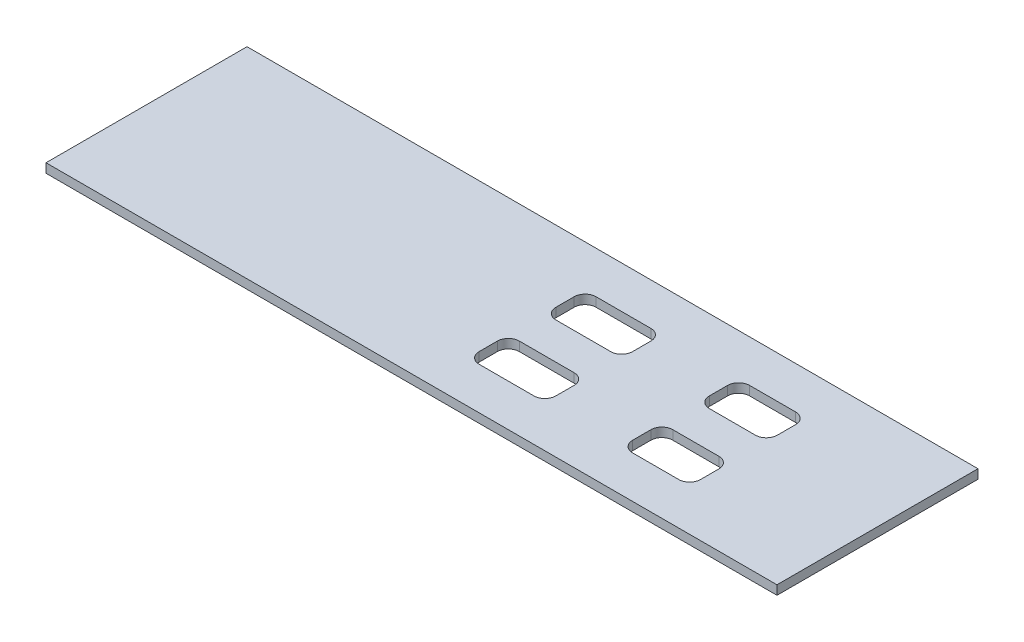
from build123d import *

# Parameters (mm, degrees)
SKETCH1_W           = 152.4
SKETCH1_H           = 69.85
BOSS_EXTRUDE1_DEPTH = 3.175
SKETCH2_W           = 26.67
SKETCH2_H           = 13.97
SKETCH2_W_2         = 23.622
CUT_EXTRUDE1_DEPTH  = 168.674873267
FILLET1_R           = 3.81
SKETCH4_W           = 69.85
SKETCH4_H           = 3.175
BOSS_EXTRUDE2_DEPTH = 101.6


with BuildPart() as part:
    # Sketch1 → Boss-Extrude1 (new body)
    with BuildSketch(Plane(origin=(0, 0, 0), x_dir=(1, 0, 0), z_dir=(0, 1, 0))):
        with Locations((76.2, 34.925)):
            Rectangle(SKETCH1_W, SKETCH1_H)
    extrude(amount=BOSS_EXTRUDE1_DEPTH)

    # Sketch2 → Cut-Extrude1 (cut, through all)
    with BuildSketch(Plane(origin=(0, 3.175, 0), x_dir=(1, 0, 0), z_dir=(0, 1, 0))):
        with Locations((43.815, 48.26)):
            Rectangle(SKETCH2_W, SKETCH2_H)
        with Locations((95.631, 48.26)):
            Rectangle(SKETCH2_W_2, SKETCH2_H)
        with Locations((43.815, 21.59)):
            Rectangle(SKETCH2_W, SKETCH2_H)
        with Locations((95.631, 21.59)):
            Rectangle(SKETCH2_W_2, SKETCH2_H)
    extrude(amount=-CUT_EXTRUDE1_DEPTH, mode=Mode.SUBTRACT)

    # Fillet1
    fillet1_edges = [part.edges().sort_by_distance(p)[0] for p in [
        (83.82, 1.5875, -14.605),
        (83.82, 1.5875, -41.275),
        (30.48, 1.5875, -41.275),
        (30.48, 1.5875, -14.605),
        (107.442, 1.5875, -14.605),
        (57.15, 1.5875, -41.275),
        (57.15, 1.5875, -14.605),
        (107.442, 1.5875, -41.275),
        (107.442, 1.5875, -28.575),
        (107.442, 1.5875, -55.245),
        (57.15, 1.5875, -28.575),
        (57.15, 1.5875, -55.245),
        (30.48, 1.5875, -28.575),
        (83.82, 1.5875, -28.575),
        (83.82, 1.5875, -55.245),
        (30.48, 1.5875, -55.245),
    ]]
    fillet(fillet1_edges, radius=FILLET1_R)

    # Sketch4 → Boss-Extrude2 (add)
    with BuildSketch(Plane.ZY):
        with Locations((-34.925, 1.5875)):
            Rectangle(SKETCH4_W, SKETCH4_H)
    extrude(amount=BOSS_EXTRUDE2_DEPTH)


solid = part.part
